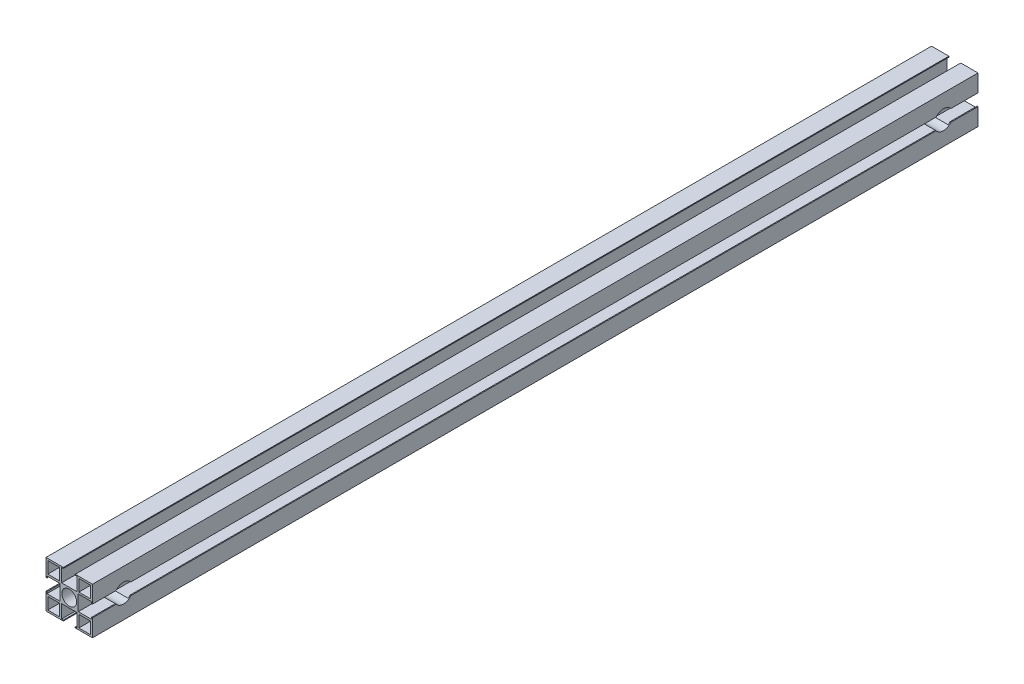
from build123d import *

# Parameters (mm, degrees)
SKETCH1_W           = 39.878
SKETCH1_H           = 39.878
BOSS_EXTRUDE1_DEPTH = 759.968
CUT_EXTRUDE1_DEPTH  = 759.968
SKETCH3_W           = 10.16
SKETCH3_H           = 10.16
CUT_EXTRUDE2_DEPTH  = 759.968
SKETCH4_R           = 6.35
CUT_EXTRUDE3_DEPTH  = 759.968
SKETCH5_R           = 8.128
CUT_EXTRUDE4_DEPTH  = 761.73309768
SKETCH5_2_R         = 8.128
CUT_EXTRUDE5_DEPTH  = 761.733097783


with BuildPart() as part:
    # Sketch1 → Boss-Extrude1 (new body)
    with BuildSketch(Plane.XY):
        Rectangle(SKETCH1_W, SKETCH1_H)
    extrude(amount=BOSS_EXTRUDE1_DEPTH)

    # Sketch2 → Cut-Extrude1 (cut)
    with BuildSketch(Plane(origin=(0, 0, 0), x_dir=(-1, 0, 0), z_dir=(0, 0, -1))):
        Polygon((-6.6421, 19.166280669), (-6.6421, 7.736280669), (6.5659, 7.736280669), (6.5659, 19.166280669), (5.0419, 19.166280669), (5.0419, 19.939), (-5.1181, 19.939), (-5.1181, 19.166280669), align=None)
    cut_extrude1 = extrude(amount=-CUT_EXTRUDE1_DEPTH, mode=Mode.SUBTRACT)

    # Mirror1: Cut-Extrude1 across plane
    add(cut_extrude1.mirror(Plane.ZX), mode=Mode.SUBTRACT)

    # Mirror2: Cut-Extrude1 across plane
    add(cut_extrude1.mirror(Plane(origin=(0, 0, 0), x_dir=(0, 0, 1), z_dir=(-0.7071067811865476, 0.7071067811865475, 0))), mode=Mode.SUBTRACT)

    # Mirror4: Cut-Extrude1 across plane
    add(cut_extrude1.mirror(Plane(origin=(0, 0, 0), x_dir=(0, 0, 1), z_dir=(-0.7071067811865475, -0.7071067811865476, 0))), mode=Mode.SUBTRACT)

    # Sketch3 → Cut-Extrude2 (cut)
    with BuildSketch(Plane(origin=(0, 0, 0), x_dir=(-1, 0, 0), z_dir=(0, 0, -1))):
        with Locations((-13.335, 13.335)):
            Rectangle(SKETCH3_W, SKETCH3_H)
        with Locations((-13.335, -13.335)):
            Rectangle(SKETCH3_W, SKETCH3_H)
        with Locations((13.335, 13.335)):
            Rectangle(SKETCH3_W, SKETCH3_H)
        with Locations((13.335, -13.335)):
            Rectangle(SKETCH3_W, SKETCH3_H)
    extrude(amount=-CUT_EXTRUDE2_DEPTH, mode=Mode.SUBTRACT)

    # Sketch4 → Cut-Extrude3 (cut)
    with BuildSketch(Plane(origin=(0, 0, 0), x_dir=(-1, 0, 0), z_dir=(0, 0, -1))):
        Circle(SKETCH4_R)
    extrude(amount=-CUT_EXTRUDE3_DEPTH, mode=Mode.SUBTRACT)

    # Sketch5 → Cut-Extrude4 (cut, through all)
    with BuildSketch(Plane(origin=(7.736280669, 0, 0), x_dir=(0, 0, -1), z_dir=(1, 0, 0))):
        with Locations((-733.360663499, 0.0381)):
            Circle(SKETCH5_R)
        with Locations((-29.609832024, 0)):
            Circle(SKETCH5_R)
    extrude(amount=-CUT_EXTRUDE4_DEPTH, mode=Mode.SUBTRACT)

    # Sketch5<2> → Cut-Extrude5 (cut, through all)
    with BuildSketch(Plane(origin=(7.736280669, 0, 0), x_dir=(0, 0, -1), z_dir=(1, 0, 0))):
        with Locations((-733.360663499, 0.0381)):
            Circle(SKETCH5_2_R)
        with Locations((-29.609832024, 0)):
            Circle(SKETCH5_2_R)
    extrude(amount=CUT_EXTRUDE5_DEPTH, mode=Mode.SUBTRACT)


solid = part.part
